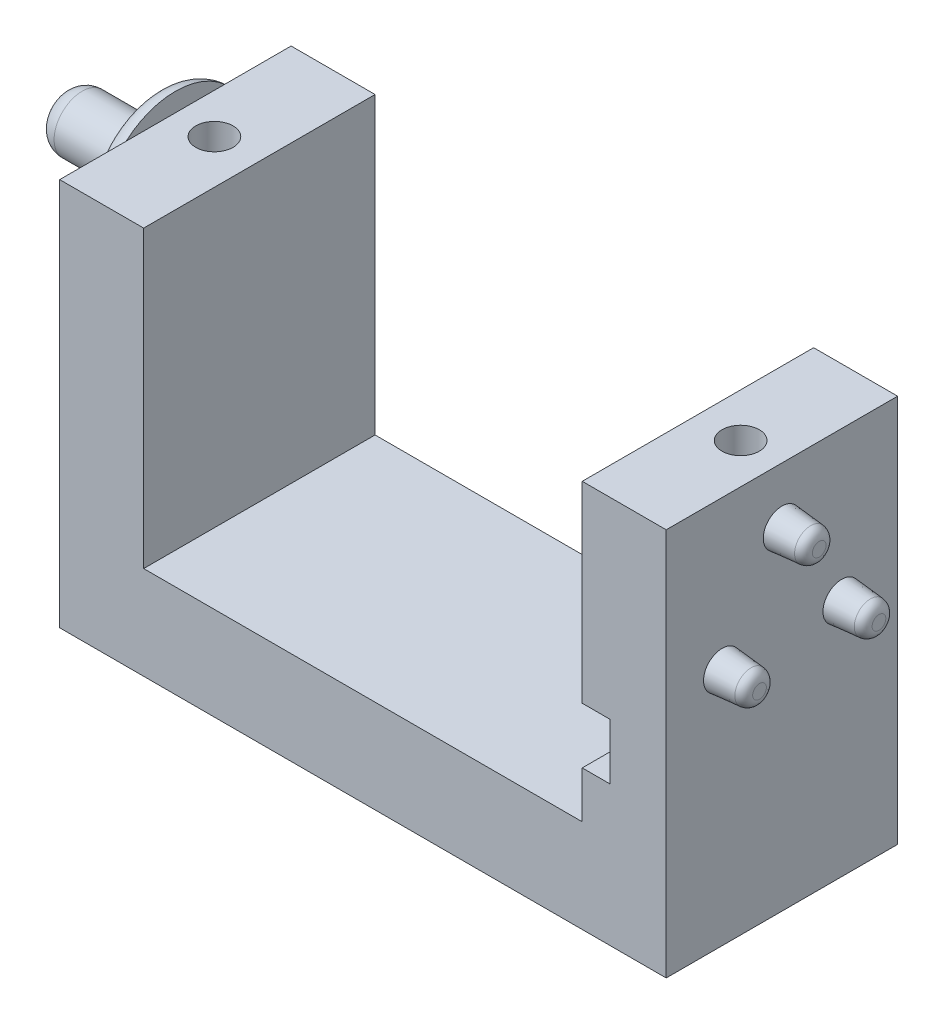
from build123d import *

# Parameters (mm, degrees)
SKETCH1_W                     = 32.5
SKETCH1_H                     = 12.4
BOSS_EXTRUDE1_DEPTH           = 5
SKETCH3_W                     = 4.5
SKETCH3_H                     = 12.4
BOSS_EXTRUDE2_DEPTH           = 15.8
SKETCH4_R                     = 1
CUT_EXTRUDE1_DEPTH            = 5
SKETCH5_R                     = 1
BOSS_EXTRUDE3_DEPTH           = 2
BOSS_EXTRUDE3_DRAFT           = 5
BOSS_EXTRUDE3_PROFILE_2_DEPTH = 2
BOSS_EXTRUDE3_PROFILE_2_DRAFT = 5
BOSS_EXTRUDE3_PROFILE_3_DEPTH = 2
BOSS_EXTRUDE3_PROFILE_3_DRAFT = 5
SKETCH6_R                     = 4
BOSS_EXTRUDE4_DEPTH           = 1
SKETCH7_R                     = 1.5
BOSS_EXTRUDE5_DEPTH           = 5
FILLET1_R                     = 1
FILLET2_R                     = 1
FILLET3_R                     = 0.5
SKETCH10_W                    = 1.5
SKETCH10_H                    = 3
CUT_EXTRUDE4_DEPTH            = 34.527041325


with BuildPart() as part:
    # Sketch1 → Boss-Extrude1 (new body)
    with BuildSketch(Plane(origin=(0, 0, 0), x_dir=(1, 0, 0), z_dir=(0, 1, 0))):
        Rectangle(SKETCH1_W, SKETCH1_H)
    extrude(amount=BOSS_EXTRUDE1_DEPTH)

    # Sketch3 → Boss-Extrude2 (add)
    with BuildSketch(Plane(origin=(0, 5, 0), x_dir=(1, 0, 0), z_dir=(0, 1, 0))):
        with Locations((-14, 0)):
            Rectangle(SKETCH3_W, SKETCH3_H)
        with Locations((14, 0)):
            Rectangle(SKETCH3_W, SKETCH3_H)
    extrude(amount=BOSS_EXTRUDE2_DEPTH)

    # Sketch4 → Cut-Extrude1 (cut)
    with BuildSketch(Plane(origin=(0, 20.8, 0), x_dir=(1, 0, 0), z_dir=(0, 1, 0))):
        with Locations(Location((14.1, -0.06, 0), (0, 0, 270))):
            Circle(SKETCH4_R)
        with Locations(Location((-14.1, -0.06, 0), (0, 0, 270))):
            Circle(SKETCH4_R)
    extrude(amount=-CUT_EXTRUDE1_DEPTH, mode=Mode.SUBTRACT)


with BuildPart() as boss_extrude3_tool:
    # Sketch5 → Boss-Extrude3 (with draft: the straight prism first)
    with BuildSketch(Plane(origin=(16.25, 0, 0), x_dir=(0, 0, -1), z_dir=(1, 0, 0))):
        with Locations((0, 17.8)):
            Circle(SKETCH5_R)
    extrude(amount=BOSS_EXTRUDE3_DEPTH)
    # Boss-Extrude3: the draft: its side faces are tilted about the plane it starts from
    boss_extrude3_sides = [boss_extrude3_tool.faces().sort_by_distance(p)[0] for p in [
        (17.25, 17.8, 1),
    ]]
    draft(boss_extrude3_sides, Plane(origin=(16.25, 0, 0), x_dir=(0, 0, -1), z_dir=(1, 0, 0)), BOSS_EXTRUDE3_DRAFT)


with BuildPart() as part_1:
    add(part.part)

    # Boss-Extrude3: add boss_extrude3_tool
    add(boss_extrude3_tool.part)


with BuildPart() as boss_extrude3_profile_2_tool:
    # Sketch5 → Boss-Extrude3 profile 2 (with draft: the straight prism first)
    with BuildSketch(Plane(origin=(16.25, 0, 0), x_dir=(0, 0, -1), z_dir=(1, 0, 0))):
        with Locations((3.2, 12.8)):
            Circle(SKETCH5_R)
    extrude(amount=BOSS_EXTRUDE3_PROFILE_2_DEPTH)
    # Boss-Extrude3 profile 2: the draft: its side faces are tilted about the plane it starts from
    boss_extrude3_profile_2_sides = [boss_extrude3_profile_2_tool.faces().sort_by_distance(p)[0] for p in [
        (17.25, 12.8, -2.2),
    ]]
    draft(boss_extrude3_profile_2_sides, Plane(origin=(16.25, 0, 0), x_dir=(0, 0, -1), z_dir=(1, 0, 0)), BOSS_EXTRUDE3_PROFILE_2_DRAFT)


with BuildPart() as part_2:
    add(part_1.part)

    # Boss-Extrude3 profile 2: add boss_extrude3_profile_2_tool
    add(boss_extrude3_profile_2_tool.part)


with BuildPart() as boss_extrude3_profile_3_tool:
    # Sketch5 → Boss-Extrude3 profile 3 (with draft: the straight prism first)
    with BuildSketch(Plane(origin=(16.25, 0, 0), x_dir=(0, 0, -1), z_dir=(1, 0, 0))):
        with Locations((-3.2, 12.8)):
            Circle(SKETCH5_R)
    extrude(amount=BOSS_EXTRUDE3_PROFILE_3_DEPTH)
    # Boss-Extrude3 profile 3: the draft: its side faces are tilted about the plane it starts from
    boss_extrude3_profile_3_sides = [boss_extrude3_profile_3_tool.faces().sort_by_distance(p)[0] for p in [
        (17.25, 12.8, 4.2),
    ]]
    draft(boss_extrude3_profile_3_sides, Plane(origin=(16.25, 0, 0), x_dir=(0, 0, -1), z_dir=(1, 0, 0)), BOSS_EXTRUDE3_PROFILE_3_DRAFT)


with BuildPart() as part_3:
    add(part_2.part)

    # Boss-Extrude3 profile 3: add boss_extrude3_profile_3_tool
    add(boss_extrude3_profile_3_tool.part)

    # Sketch6 → Boss-Extrude4 (add)
    with BuildSketch(Plane.ZY.offset(16.25)):
        with Locations(Location((0, 17.8, 0), (0, 0, 131.409622109))):
            Circle(SKETCH6_R)
    extrude(amount=BOSS_EXTRUDE4_DEPTH)

    # Sketch7 → Boss-Extrude5 (add)
    with BuildSketch(Plane.ZY.offset(17.25)):
        with Locations((0, 17.8)):
            Circle(SKETCH7_R)
    extrude(amount=BOSS_EXTRUDE5_DEPTH)

    # Fillet1
    fillet1_edges = [part_3.edges().sort_by_distance(p)[0] for p in [
        (-22.25, 17.8, -1.5),
    ]]
    fillet(fillet1_edges, radius=FILLET1_R)

    # Fillet2
    fillet2_edges = [part_3.edges().sort_by_distance(p)[0] for p in [
        (-17.25, 14.8, 2.645751311),
    ]]
    fillet(fillet2_edges, radius=FILLET2_R - 0.0001)  # a hair under: the kernel refuses the full size

    # Fillet3
    fillet3_edges = [part_3.edges().sort_by_distance(p)[0] for p in [
        (18.25, 17.8, 0.825022673),
        (18.25, 12.8, -2.374977327),
        (18.25, 12.8, 4.025022673),
    ]]
    fillet(fillet3_edges, radius=FILLET3_R)

    # Sketch10 → Cut-Extrude4 (cut, through all)
    with BuildSketch(Plane(origin=(0, 0, -6.2), x_dir=(-1, 0, 0), z_dir=(0, 0, -1))):
        with Locations((-12.5, 9)):
            Rectangle(SKETCH10_W, SKETCH10_H)
    extrude(amount=-CUT_EXTRUDE4_DEPTH, mode=Mode.SUBTRACT)


solid = part_3.part
